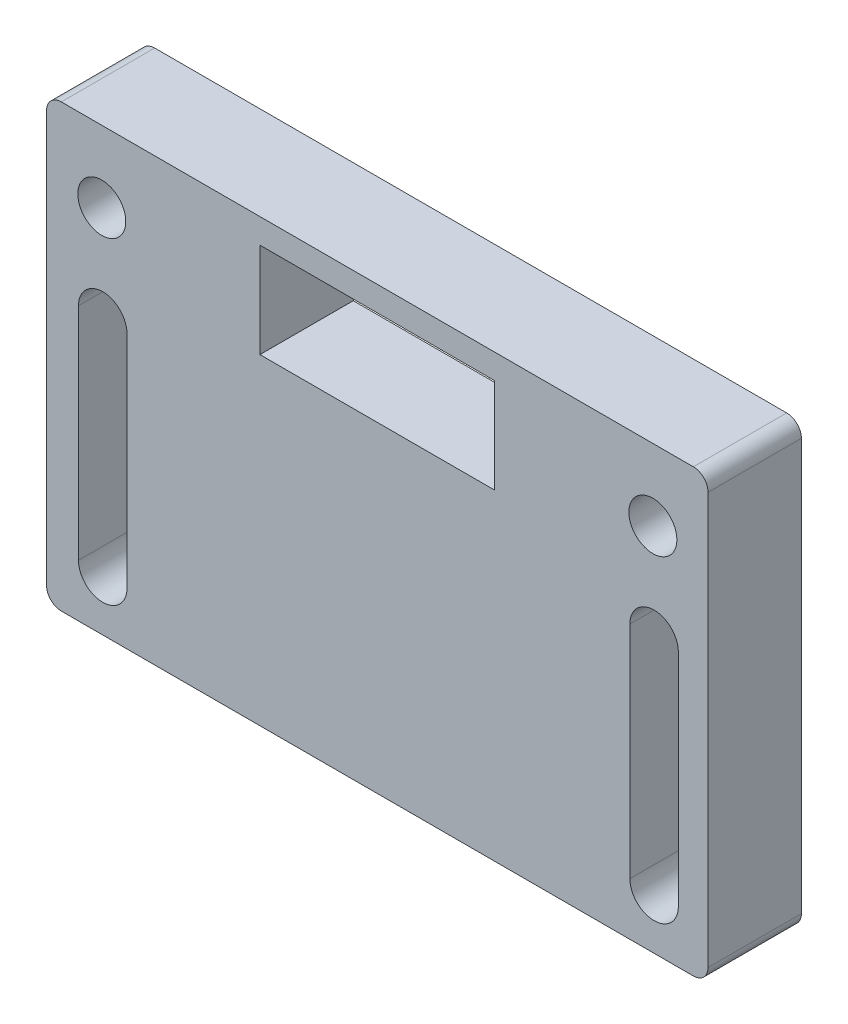
from build123d import *

# Parameters (mm, degrees)
SKETCH1_W                                        = 90
SKETCH1_H                                        = 60
BOSS_EXTRUDE1_DEPTH                              = 12.7
CSK_FOR_1_4_FLAT_HEAD_MACHINE_SCREW1_D           = 6.5278
CSK_FOR_1_4_FLAT_HEAD_MACHINE_SCREW1_CSINK_D     = 12.8778
CSK_FOR_1_4_FLAT_HEAD_MACHINE_SCREW1_CSINK_ANGLE = 82
FILLET1_R                                        = 2
CUT_EXTRUDE1_DEPTH                               = 109.909549627


with BuildPart() as part:
    # Sketch1 → Boss-Extrude1 (new body)
    with BuildSketch(Plane.XY):
        with Locations((45, -30)):
            Rectangle(SKETCH1_W, SKETCH1_H)
        Polygon((29.025, -3.367091904), (29.025, -16.267091904), (60.975, -16.267091904), (60.975, -3.367091904), (45, -3.367091904), align=None, mode=Mode.SUBTRACT)
    extrude(amount=BOSS_EXTRUDE1_DEPTH)

    # CSK for 1/4 Flat Head Machine Screw1 (through all)
    with Locations(Plane(origin=(0, 0, 0), x_dir=(-1, 0, 0), z_dir=(0, 0, -1))):
        with Locations((-82.49, -9.717091904), (-7.51, -9.717091904)):
            CounterSinkHole(CSK_FOR_1_4_FLAT_HEAD_MACHINE_SCREW1_D / 2, CSK_FOR_1_4_FLAT_HEAD_MACHINE_SCREW1_CSINK_D / 2, counter_sink_angle=CSK_FOR_1_4_FLAT_HEAD_MACHINE_SCREW1_CSINK_ANGLE)

    # Fillet1
    fillet1_edges = [part.edges().sort_by_distance(p)[0] for p in [
        (0, -60, 6.35),
        (0, 0, 6.35),
        (90, 0, 6.35),
        (90, -60, 6.35),
    ]]
    fillet(fillet1_edges, radius=FILLET1_R)

    # Sketch5 → Cut-Extrude1 (cut, through all)
    with BuildSketch(Plane(origin=(0, 0, 0), x_dir=(-1, 0, 0), z_dir=(0, 0, -1))):
        with BuildLine():
            Line((-10.939220103, -22.847364981), (-10.939220103, -52.847364981))
            ThreePointArc((-10.939220103, -52.847364981), (-7.639220103, -56.147364981), (-4.339220103, -52.847364981))
            Line((-4.339220103, -52.847364981), (-4.339220103, -22.847364981))
            ThreePointArc((-4.339220103, -22.847364981), (-7.639220103, -19.547364981), (-10.939220103, -22.847364981))
        make_face()
        with BuildLine():
            Line((-79.359220103, -52.847364981), (-79.359220103, -22.847364981))
            ThreePointArc((-79.359220103, -22.847364981), (-82.659220103, -19.547364981), (-85.959220103, -22.847364981))
            Line((-85.959220103, -22.847364981), (-85.959220103, -52.847364981))
            ThreePointArc((-85.959220103, -52.847364981), (-82.659220103, -56.147364981), (-79.359220103, -52.847364981))
        make_face()
    extrude(amount=-CUT_EXTRUDE1_DEPTH, mode=Mode.SUBTRACT)


solid = part.part
